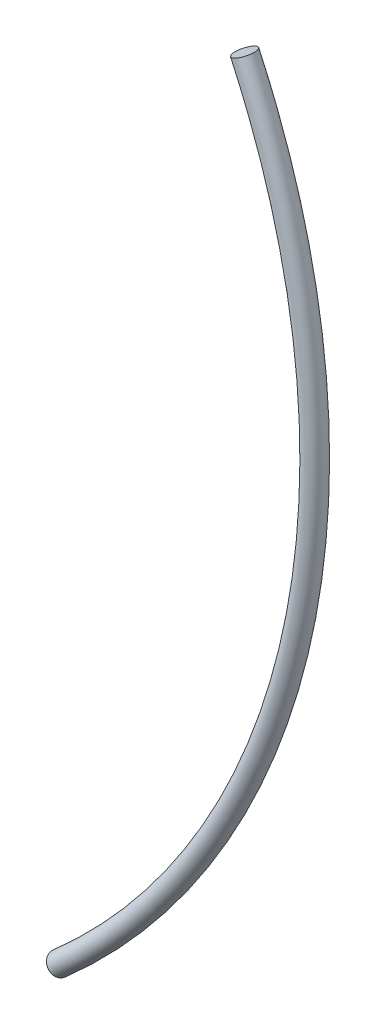
from build123d import *

# Parameters (mm, degrees)
VARREDURA1_PROFILE_R = 2.5


with BuildPart() as part:
    # Varredura1: sweep along a path in Esboço1
    with BuildLine(Plane.XY) as varredura1_path:
        ThreePointArc((114.665939123, -117.006313722), (171.704371086, -19.358729661), (158.844821082, 92.993686278))
    # Varredura1 profile (on start of the path) → Varredura1 (sweep)
    with BuildSketch(Plane(origin=(114.665939123, -117.006313722, 0), x_dir=(-0.6599993200710162, 0.7512661961687057, 0), z_dir=(0.7512661961687057, 0.6599993200710162, 0))):
        Circle(VARREDURA1_PROFILE_R)
    sweep(path=varredura1_path.line)


solid = part.part
